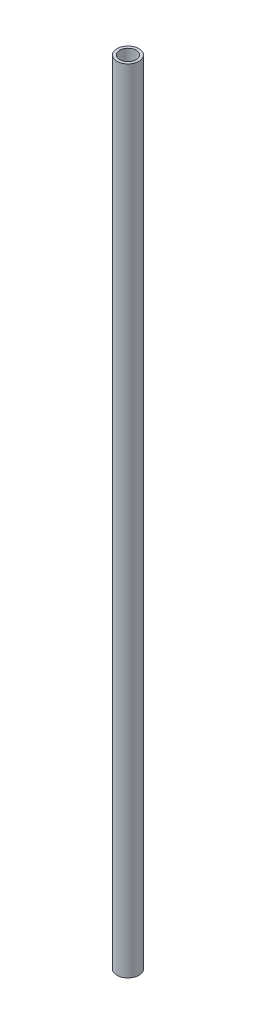
from build123d import *

# Parameters (mm, degrees)
SKETCH1_R           = 12.7
SKETCH1_R_2         = 9.525
BOSS_EXTRUDE1_DEPTH = 914.4


with BuildPart() as part:
    # Sketch1 → Boss-Extrude1 (new body)
    with BuildSketch(Plane(origin=(0, 0, 0), x_dir=(1, 0, 0), z_dir=(0, 1, 0))):
        Circle(SKETCH1_R)
        Circle(SKETCH1_R_2, mode=Mode.SUBTRACT)
    extrude(amount=BOSS_EXTRUDE1_DEPTH)


solid = part.part
